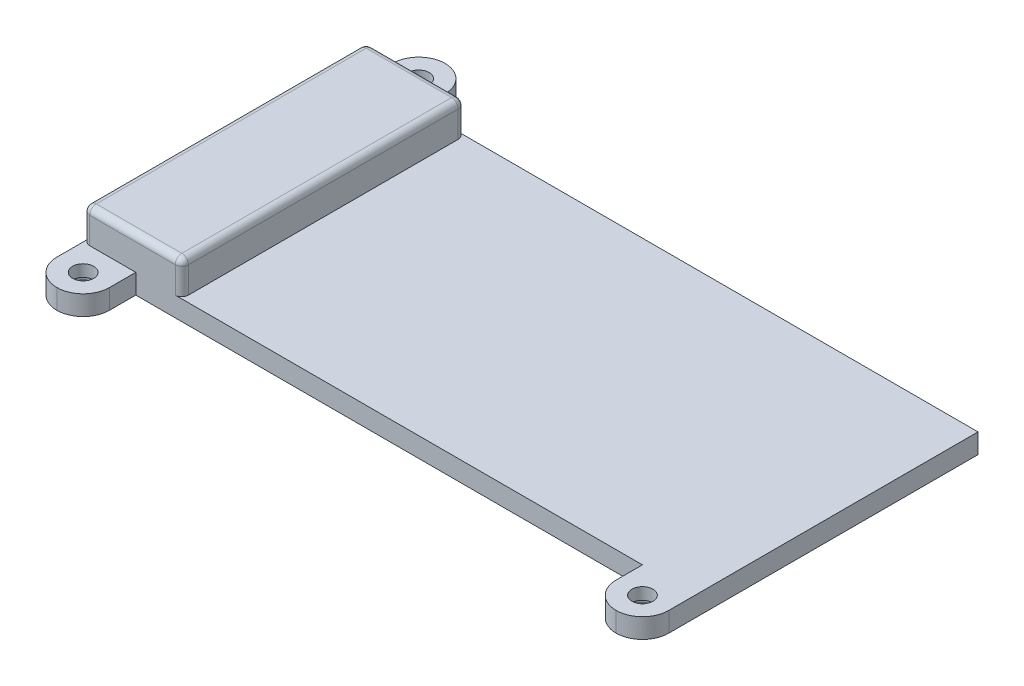
from build123d import *

# Parameters (mm, degrees)
EXTRUDE_1_DEPTH     = 3
FILLET_1_R          = 4
SKETCH_2_R          = 1.6
CUT_EXTRUDE_1_DEPTH = 3
SKETCH_3_R          = 2.8
CUT_EXTRUDE_2_DEPTH = 1.2
SKETCH_4_W          = 15
SKETCH_4_H          = 43
EXTRUDE_2_DEPTH     = 5
FILLET_2_R          = 1
SKETCH_5_W          = 21.917819233
SKETCH_5_H          = 11.553011577
CUT_EXTRUDE_3_DEPTH = 10


with BuildPart() as part:
    # 草图1 → 凸台-拉伸1 (new body)
    with BuildSketch(Plane(origin=(0, 0, 0), x_dir=(1, 0, 0), z_dir=(0, 1, 0))):
        Polygon((-38.5, -21.5), (38.5, -21.5), (38.5, -29.5), (46.5, -29.5), (46.5, -21.5), (46.5, 21.5), (46.5, 29.5), (38.5, 29.5), (38.5, 21.5), (-38.5, 21.5), (-38.5, 29.5), (-46.5, 29.5), (-46.5, 21.5), (-46.5, -21.5), (-46.5, -29.5), (-38.5, -29.5), align=None)
    extrude(amount=EXTRUDE_1_DEPTH)

    # 圆角1
    fillet_1_edges = [part.edges().sort_by_distance(p)[0] for p in [
        (38.5, 1.5, 29.5),
        (46.5, 1.5, 29.5),
        (-46.5, 1.5, 29.5),
        (-38.5, 1.5, 29.5),
        (-46.5, 1.5, -29.5),
        (-38.5, 1.5, -29.5),
        (38.5, 1.5, -29.5),
        (46.5, 1.5, -29.5),
    ]]
    fillet(fillet_1_edges, radius=FILLET_1_R - 0.0001)  # a hair under: the kernel refuses the full size

    # 草图2 → 切除-拉伸1 (cut)
    with BuildSketch(Plane.XZ):
        with Locations(Location((42.5, 25.5, 0), (0, 0, 270))):
            Circle(SKETCH_2_R)
        with Locations(Location((42.5, -25.5, 0), (0, 0, 90))):
            Circle(SKETCH_2_R)
        with Locations(Location((-42.5, -25.5, 0), (0, 0, 270))):
            Circle(SKETCH_2_R)
        with Locations(Location((-42.5, 25.5, 0), (0, 0, 90))):
            Circle(SKETCH_2_R)
    extrude(amount=-CUT_EXTRUDE_1_DEPTH, mode=Mode.SUBTRACT)

    # 草图3 → 切除-拉伸2 (cut)
    with BuildSketch(Plane.XZ):
        with Locations(Location((-42.5, 25.5, 0), (0, 0, 90))):
            Circle(SKETCH_3_R)
        with Locations(Location((42.5, 25.5, 0), (0, 0, 270))):
            Circle(SKETCH_3_R)
        with Locations(Location((42.5, -25.5, 0), (0, 0, 90))):
            Circle(SKETCH_3_R)
        with Locations(Location((-42.5, -25.5, 0), (0, 0, 270))):
            Circle(SKETCH_3_R)
    extrude(amount=-CUT_EXTRUDE_2_DEPTH, mode=Mode.SUBTRACT)

    # 草图4 → 凸台-拉伸2 (add)
    with BuildSketch(Plane(origin=(0, 3, 0), x_dir=(1, 0, 0), z_dir=(0, 1, 0))):
        with Locations((-39, 0)):
            Rectangle(SKETCH_4_W, SKETCH_4_H)
    extrude(amount=EXTRUDE_2_DEPTH)

    # 圆角2
    fillet_2_edges = [part.edges().sort_by_distance(p)[0] for p in [
        (-31.5, 5.5, 21.5),
        (-31.5, 5.5, -21.5),
        (-46.5, 5.5, -21.5),
        (-46.5, 5.5, 21.5),
        (-31.5, 8, 0),
        (-39, 8, -21.5),
        (-46.5, 8, 0),
        (-39, 8, 21.5),
    ]]
    fillet(fillet_2_edges, radius=FILLET_2_R)

    # 草图5 → 切除-拉伸3 (cut)
    with BuildSketch(Plane.XZ):
        with Locations((42.014050272, -27.276505788)):
            Rectangle(SKETCH_5_W, SKETCH_5_H)
    extrude(amount=-CUT_EXTRUDE_3_DEPTH, mode=Mode.SUBTRACT)


solid = part.part
